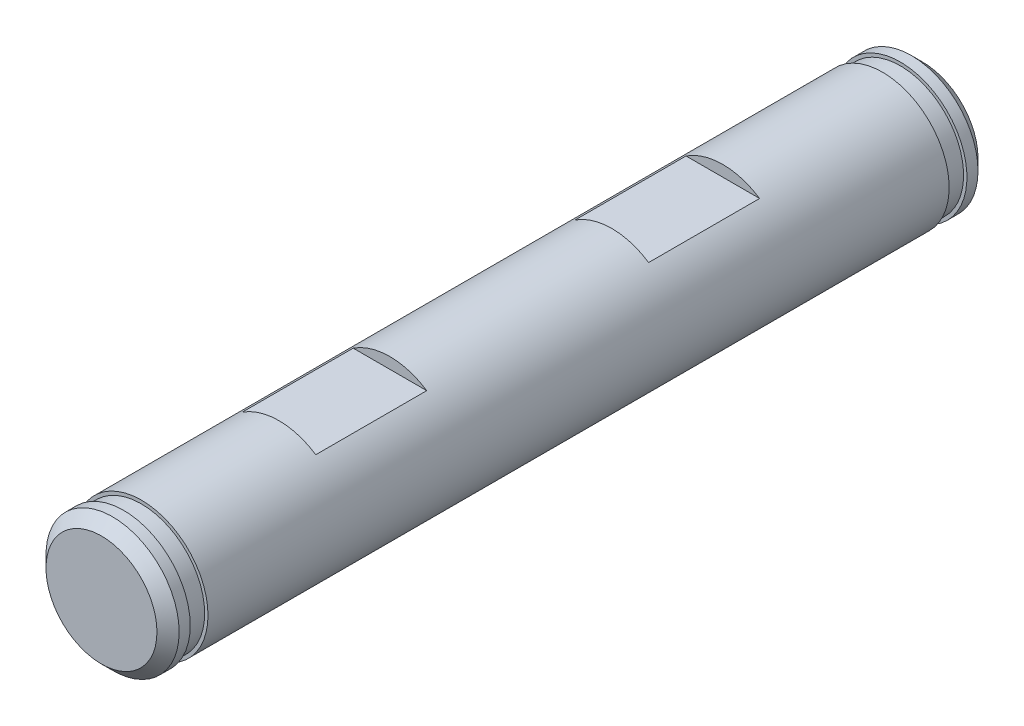
from build123d import *

# Parameters (mm, degrees)
SZKIC1_R                    = 3
DODANIE_WYCI_GNI_CIE1_DEPTH = 37
SFAZOWANIE1_SIZE            = 0.5
WYTNIJ_WYCI_GNI_CIE1_START  = -1.8
SZKIC2_R                    = 3
SZKIC2_R_2                  = 2.85
WYTNIJ_WYCI_GNI_CIE1_DEPTH  = 0.8
WYTNIJ_WYCI_GNI_CIE2_START  = -1
SZKIC3_R                    = 3
SZKIC3_R_2                  = 2.85
WYTNIJ_WYCI_GNI_CIE2_DEPTH  = 0.8
WYTNIJ_WYCI_GNI_CIE3_START  = -13
WYTNIJ_WYCI_GNI_CIE3_DEPTH  = 5
WYTNIJ_WYCI_GNI_CIE4_START  = -28
WYTNIJ_WYCI_GNI_CIE4_DEPTH  = 5


with BuildPart() as part:
    # Szkic1 → Dodanie-wyciągnięcie1 (new body)
    with BuildSketch(Plane.XY):
        Circle(SZKIC1_R)
    extrude(amount=DODANIE_WYCI_GNI_CIE1_DEPTH)

    # Sfazowanie1
    sfazowanie1_edges = [part.edges().sort_by_distance(p)[0] for p in [
        (-3, 0, 0),
        (-3, 0, 37),
    ]]
    chamfer(sfazowanie1_edges, length=SFAZOWANIE1_SIZE)

    # Szkic2 → Wytnij-wyciągnięcie1 (cut)
    with BuildSketch(Plane.XY.offset(37).offset(WYTNIJ_WYCI_GNI_CIE1_START)):
        Circle(SZKIC2_R)
        Circle(SZKIC2_R_2, mode=Mode.SUBTRACT)
    extrude(amount=WYTNIJ_WYCI_GNI_CIE1_DEPTH, mode=Mode.SUBTRACT)

    # Szkic3 → Wytnij-wyciągnięcie2 (cut)
    with BuildSketch(Plane(origin=(0, 0, 0), x_dir=(-1, 0, 0), z_dir=(0, 0, -1)).offset(WYTNIJ_WYCI_GNI_CIE2_START)):
        Circle(SZKIC3_R)
        Circle(SZKIC3_R_2, mode=Mode.SUBTRACT)
    extrude(amount=-WYTNIJ_WYCI_GNI_CIE2_DEPTH, mode=Mode.SUBTRACT)

    # Szkic4 → Wytnij-wyciągnięcie3 (cut)
    with BuildSketch(Plane.XY.offset(37).offset(WYTNIJ_WYCI_GNI_CIE3_START)):
        with BuildLine():
            Line((-1.658312395, 2.5), (1.658312395, 2.5))
            ThreePointArc((1.658312395, 2.5), (0, 3), (-1.658312395, 2.5))
        make_face()
    extrude(amount=WYTNIJ_WYCI_GNI_CIE3_DEPTH, mode=Mode.SUBTRACT)

    # Szkic4<2> → Wytnij-wyciągnięcie4 (cut)
    with BuildSketch(Plane.XY.offset(37).offset(WYTNIJ_WYCI_GNI_CIE4_START)):
        with BuildLine():
            Line((-1.658312395, 2.5), (1.658312395, 2.5))
            ThreePointArc((1.658312395, 2.5), (0, 3), (-1.658312395, 2.5))
        make_face()
    extrude(amount=WYTNIJ_WYCI_GNI_CIE4_DEPTH, mode=Mode.SUBTRACT)


solid = part.part
